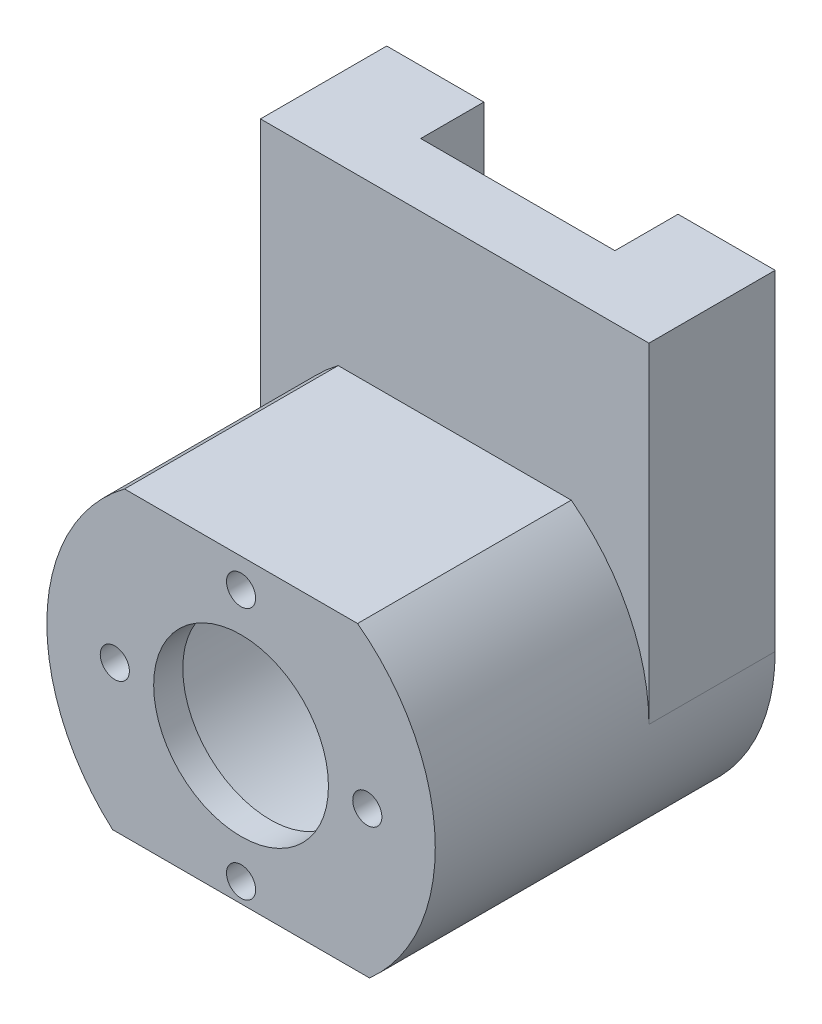
from build123d import *
from build123d.topology import SkipClean

# Parameters (mm, degrees)
ESQUISSE1_R           = 15
ESQUISSE1_R_2         = 5
ESQUISSE1_R_3         = 2
EXTRUSION1_DEPTH      = 5
ESQUISSE2_R           = 9
ESQUISSE2_R_2         = 1.5
EXTRUSION2_DEPTH      = 30
ESQUISSE3_R           = 15
EXTRUSION3_DEPTH      = 27
EXTRUSION4_DEPTH      = 104.198837203
EXTRUSION4_DEPTH_BACK = 104.198837203
EXTRUSION5_START      = -10
EXTRUSION5_DEPTH      = 10
EXTRUSION6_START      = 5
EXTRUSION6_DEPTH      = 8
EXTRUSION7_REACH      = 69.387
EXTRUSION7_END_RADIUS = 15
ESQUISSE7_W           = 20
ESQUISSE7_H           = 6.5


# Read off the part's stored shape, not the designer's step: Extrusion6
with BuildPart() as part:
    # Esquisse1 → Extrusion1 (new body)
    with BuildSketch(Plane.XY):
        with BuildLine():
            Line((20, -20), (20, -75))
            ThreePointArc((20, -75), (0, -95), (-20, -75))
            Line((-20, -75), (-20, -20))
            ThreePointArc((-20, -20), (0, 0), (20, -20))
        make_face()
        with Locations((0, -75)):
            Circle(ESQUISSE1_R, mode=Mode.SUBTRACT)
        with Locations((0, -20)):
            Circle(ESQUISSE1_R_2, mode=Mode.SUBTRACT)
        with Locations((-14, -20)):
            Circle(ESQUISSE1_R_3, mode=Mode.SUBTRACT)
        with Locations((-9.899494937, -10.100505063)):
            Circle(ESQUISSE1_R_3, mode=Mode.SUBTRACT)
        with Locations((0, -6)):
            Circle(ESQUISSE1_R_3, mode=Mode.SUBTRACT)
        with Locations((9.899494937, -10.100505063)):
            Circle(ESQUISSE1_R_3, mode=Mode.SUBTRACT)
        with Locations((14, -20)):
            Circle(ESQUISSE1_R_3, mode=Mode.SUBTRACT)
        with Locations((9.899494937, -29.899494937)):
            Circle(ESQUISSE1_R_3, mode=Mode.SUBTRACT)
        with Locations((0, -34)):
            Circle(ESQUISSE1_R_3, mode=Mode.SUBTRACT)
        with Locations((-9.899494937, -29.899494937)):
            Circle(ESQUISSE1_R_3, mode=Mode.SUBTRACT)
    extrude(amount=EXTRUSION1_DEPTH)

    # Esquisse2 → Extrusion2 (add)
    with SkipClean():  # the faces are left unmerged after this step: merging them gives an invalid solid
        with BuildSketch(Plane.XY.offset(5)):
            with BuildLine():
                Line((12, -59), (-12, -59))
                ThreePointArc((-12, -59), (0, -95), (12, -59))
            make_face()
            with Locations((0, -75)):
                Circle(ESQUISSE2_R, mode=Mode.SUBTRACT)
            with Locations((0, -62)):
                Circle(ESQUISSE2_R_2, mode=Mode.SUBTRACT)
            with Locations((0, -88)):
                Circle(ESQUISSE2_R_2, mode=Mode.SUBTRACT)
            with Locations((-13, -75)):
                Circle(ESQUISSE2_R_2, mode=Mode.SUBTRACT)
            with Locations((13, -75)):
                Circle(ESQUISSE2_R_2, mode=Mode.SUBTRACT)
        extrude(amount=EXTRUSION2_DEPTH)

    # Esquisse3 → Extrusion3 (cut)
    with SkipClean():  # the faces are left unmerged after this step: merging them gives an invalid solid
        with BuildSketch(Plane(origin=(0, 0, 5), x_dir=(-1, 0, 0), z_dir=(0, 0, -1))):
            with Locations((0, -75)):
                Circle(ESQUISSE3_R)
        extrude(amount=-EXTRUSION3_DEPTH, mode=Mode.SUBTRACT)

    # Esquisse4 → Extrusion4 (cut, two sides: drawn at the far end of the back side and taken through both)
    with SkipClean():  # the faces are left unmerged after this step: merging them gives an invalid solid
        with BuildSketch(Plane(origin=(0, 0, 0), x_dir=(0, 0, -1), z_dir=(1, 0, 0)).offset(-EXTRUSION4_DEPTH_BACK)):
            Polygon((-35, -95), (-30, -95), (-35, -90), align=None)
        extrude(amount=EXTRUSION4_DEPTH + EXTRUSION4_DEPTH_BACK, mode=Mode.SUBTRACT)

    # Esquisse5 → Extrusion5 (cut)
    with SkipClean():  # the faces are left unmerged after this step: merging them gives an invalid solid
        with BuildSketch(Plane.XY.offset(5).offset(EXTRUSION5_START)):
            with BuildLine():
                Line((20, -41), (-20, -41))
                Line((-20, -41), (-20, -20))
                ThreePointArc((-20, -20), (0, 0), (20, -20))
                Line((20, -20), (20, -41))
            make_face()
        extrude(amount=EXTRUSION5_DEPTH, mode=Mode.SUBTRACT)

    # Extrusion6 outline → Extrusion6 (add)
    with SkipClean():  # the faces are left unmerged after this step: merging them gives an invalid solid
        with BuildSketch(Plane.XY.offset(EXTRUSION6_START)):
            with BuildLine():
                Line((-20, -41), (-20, -75))
                ThreePointArc((-20, -75), (-17.88854382, -66.05572809), (-12, -59))
                Line((-12, -59), (12, -59))
                ThreePointArc((12, -59), (17.88854382, -66.05572809), (20, -75))
                Line((20, -75), (20, -41))
                Line((20, -41), (-20, -41))
            make_face()
        extrude(amount=EXTRUSION6_DEPTH)

    # Extrusion7: up to this cylinder (the profile starts outside it)
    with SkipClean():  # the faces are left unmerged after this step: merging them gives an invalid solid
        extrusion7_end = Plane(origin=(0, -75, 3.25), z_dir=(0, 0, -1)) * Cylinder(EXTRUSION7_END_RADIUS, 169.774, mode=Mode.PRIVATE)
        # Esquisse7 → Extrusion7 (cut, up to the surface)
        with BuildSketch(Plane(origin=(0, -41, 0), x_dir=(1, 0, 0), z_dir=(0, 1, 0)), mode=Mode.PRIVATE) as extrusion7_sk1:
            with Locations((0, -3.25)):
                Rectangle(ESQUISSE7_W, ESQUISSE7_H)
        extrusion7_tool1 = extrude(extrusion7_sk1.sketch, amount=-EXTRUSION7_REACH, mode=Mode.PRIVATE) - extrusion7_end
        add(extrusion7_tool1.solids().sort_by_distance((0, -41, 3.25))[0], mode=Mode.SUBTRACT)


solid = part.part
